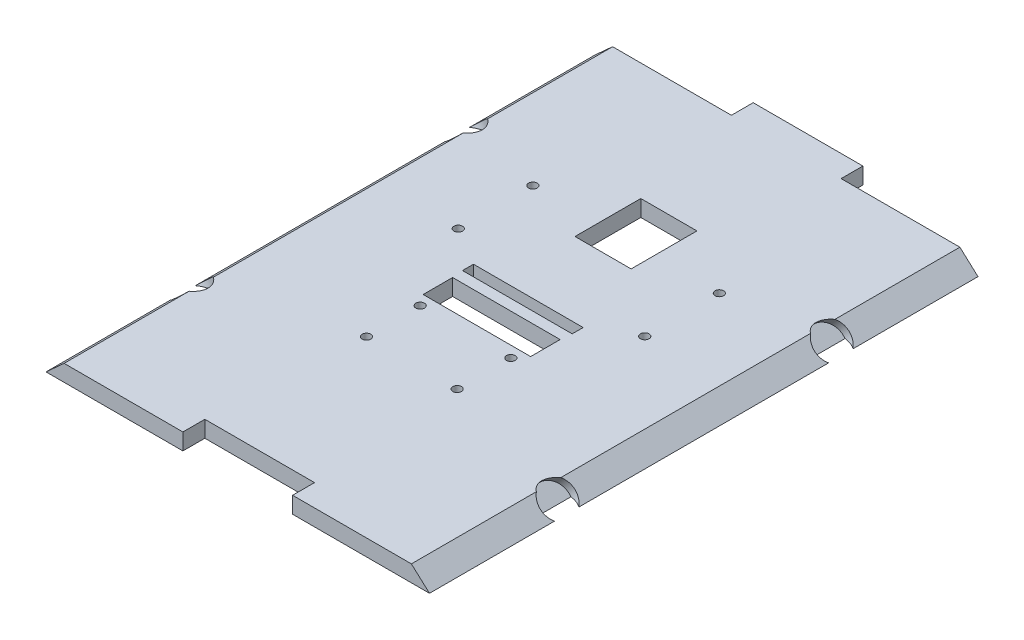
from build123d import *

# Parameters (mm, degrees)
BOSS_EXTRUDE1_DEPTH = 127
SKETCH3_W           = 25.4
SKETCH3_H           = 5.08
CUT_EXTRUDE1_DEPTH  = 135.591199998
SKETCH4_W           = 25.4
SKETCH4_H           = 5.08
BOSS_EXTRUDE3_DEPTH = 3.81
SKETCH5_R           = 1
SKETCH5_R_2         = 0.999998
SKETCH5_W           = 13
SKETCH5_H           = 15.24
SKETCH5_W_2         = 25.4
SKETCH5_H_2         = 2.54
SKETCH5_W_3         = 24.892
SKETCH5_H_3         = 6.822527996
CUT_EXTRUDE2_DEPTH  = 135.591199998
SKETCH6_R           = 4
CUT_EXTRUDE3_DEPTH  = 2
SKETCH7_R           = 4
CUT_EXTRUDE4_DEPTH  = 2


with BuildPart() as part:
    # Sketch1 → Boss-Extrude1 (new body)
    with BuildSketch(Plane.XY):
        Polygon((-40.203883769, 5.937788296), (40.203883769, 5.937788296), (44.399042974, 2.127788296), (-44.399042974, 2.127788296), align=None)
    extrude(amount=BOSS_EXTRUDE1_DEPTH)

    # Sketch3 → Cut-Extrude1 (cut, through all)
    with BuildSketch(Plane.XZ.offset(-2.127788296)):
        with Locations((0, 124.46)):
            Rectangle(SKETCH3_W, SKETCH3_H)
    extrude(amount=-CUT_EXTRUDE1_DEPTH, mode=Mode.SUBTRACT)

    # Sketch4 → Boss-Extrude3 (add)
    with BuildSketch(Plane.XZ.offset(-2.127788296)):
        with Locations((0, -2.504739817)):
            Rectangle(SKETCH4_W, SKETCH4_H)
    extrude(amount=-BOSS_EXTRUDE3_DEPTH)

    # Sketch5 → Cut-Extrude2 (cut, through all)
    with BuildSketch(Plane(origin=(0, 2.127788296, 0), x_dir=(-1, 0, 0), z_dir=(0, -1, 0))):
        with Locations((21.59, -54.356)):
            Circle(SKETCH5_R)
        with Locations((21.59, -37.084)):
            Circle(SKETCH5_R)
        with Locations((-21.59, -37.084)):
            Circle(SKETCH5_R)
        with Locations((-21.59, -54.356)):
            Circle(SKETCH5_R)
        with Locations((-10.44215584, -74.203260183)):
            Circle(SKETCH5_R)
        with Locations((-10.44215584, -86.649260183)):
            Circle(SKETCH5_R)
        with Locations((10.55784416, -74.203260183)):
            Circle(SKETCH5_R)
        with Locations((10.55784416, -86.649260183)):
            Circle(SKETCH5_R)
        with Locations((-93.931058926, -72.649749874)):
            Circle(SKETCH5_R_2)
        with Locations((-93.931058926, -85.149749874)):
            Circle(SKETCH5_R)
        with Locations((-72.931058926, -72.649749874)):
            Circle(SKETCH5_R)
        with Locations((-72.931058926, -85.149749874)):
            Circle(SKETCH5_R)
        with Locations((-93.904836904, 5.641456719)):
            Circle(SKETCH5_R)
        with Locations((-53.184836904, 5.641456719)):
            Circle(SKETCH5_R)
        with Locations((-53.184836904, -9.358543281)):
            Circle(SKETCH5_R)
        with Locations((-93.904836904, -9.358543281)):
            Circle(SKETCH5_R)
        with Locations((0, -34.798)):
            Rectangle(SKETCH5_W, SKETCH5_H)
        with Locations((0, -60.995260183)):
            Rectangle(SKETCH5_W_2, SKETCH5_H_2)
        with Locations((0, -68.216524181)):
            Rectangle(SKETCH5_W_3, SKETCH5_H_3)
    extrude(amount=-CUT_EXTRUDE2_DEPTH, mode=Mode.SUBTRACT)

    # Sketch6 → Cut-Extrude3 (cut)
    with BuildSketch(Plane(origin=(-21.127225221, 23.263011377, 0), x_dir=(0.7402720771062569, 0.6723074087475075, 0), z_dir=(-0.6723074087475075, 0.7402720771062569, 0))):
        with Locations((-28.603318705, -31.759160613)):
            Circle(SKETCH6_R)
        with Locations((-28.603318705, -95.240839387)):
            Circle(SKETCH6_R)
    extrude(amount=-CUT_EXTRUDE3_DEPTH, mode=Mode.SUBTRACT)

    # Sketch7 → Cut-Extrude4 (cut)
    with BuildSketch(Plane(origin=(21.127225221, 23.263011377, 0), x_dir=(0.7402720771062569, -0.6723074087475075, 0), z_dir=(0.6723074087475075, 0.7402720771062569, 0))):
        with Locations((28.603318705, -95.23743448)):
            Circle(SKETCH7_R)
        with Locations((28.603318705, -31.76256552)):
            Circle(SKETCH7_R)
    extrude(amount=-CUT_EXTRUDE4_DEPTH, mode=Mode.SUBTRACT)


solid = part.part
